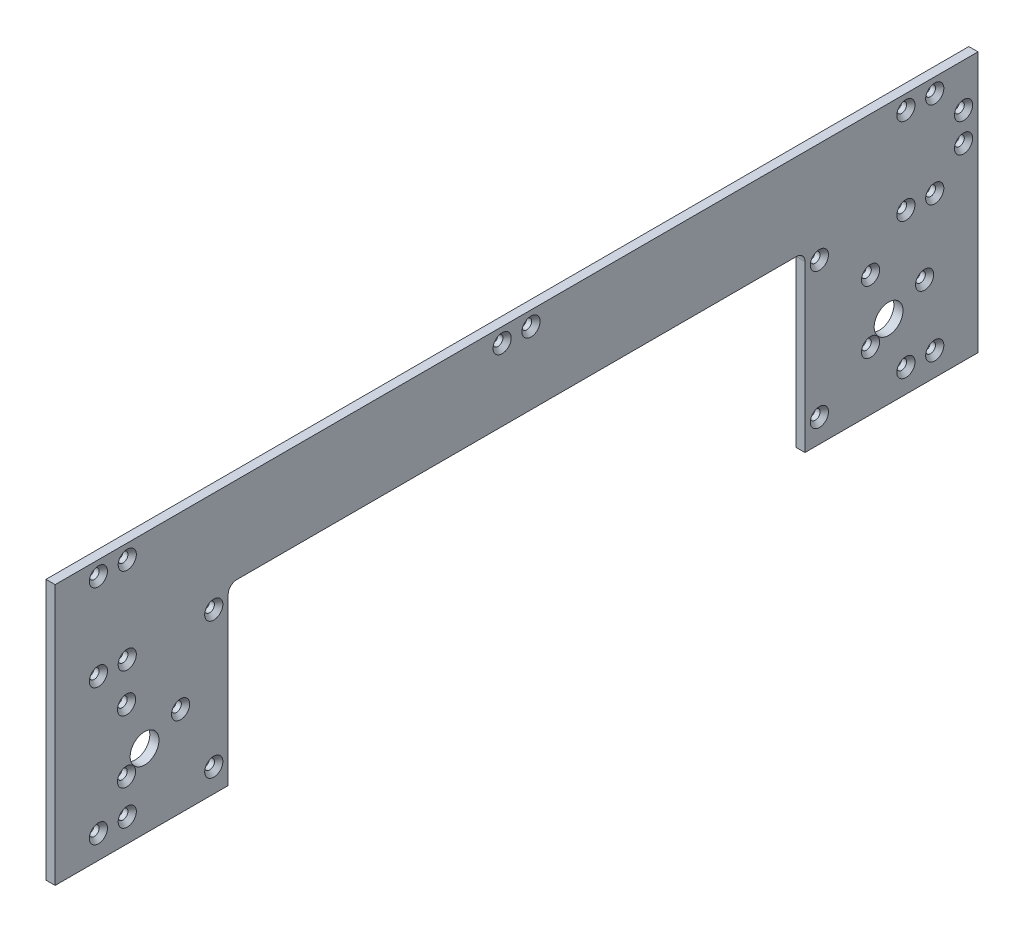
from build123d import *

# Parameters (mm, degrees)
BOSS_EXTRUDE1_DEPTH                             = 3.175
CSK_FOR_M3_FLAT_HEAD_MACHINE_SCREW1_D           = 3.4
CSK_FOR_M3_FLAT_HEAD_MACHINE_SCREW1_CSINK_D     = 6.3
CSK_FOR_M3_FLAT_HEAD_MACHINE_SCREW1_CSINK_ANGLE = 90
SKETCH4_R                                       = 5
CUT_EXTRUDE1_DEPTH                              = 184.774870766
CSK_FOR_M3_FLAT_HEAD_MACHINE_SCREW2_D           = 3.4
CSK_FOR_M3_FLAT_HEAD_MACHINE_SCREW2_CSINK_D     = 6.3
CSK_FOR_M3_FLAT_HEAD_MACHINE_SCREW2_CSINK_ANGLE = 90
CSK_FOR_M3_FLAT_HEAD_MACHINE_SCREW3_D           = 3.4
CSK_FOR_M3_FLAT_HEAD_MACHINE_SCREW3_CSINK_D     = 6.3
CSK_FOR_M3_FLAT_HEAD_MACHINE_SCREW3_CSINK_ANGLE = 90
LPATTERN1_COUNT                                 = 2
LPATTERN1_PITCH                                 = 258


with BuildPart() as part:
    # Sketch1 → Boss-Extrude1 (new body)
    with BuildSketch(Plane(origin=(0, 0, 0), x_dir=(0, 0, -1), z_dir=(1, 0, 0))):
        Polygon((160, 0), (160, 3.175), (160, 47.175), (160, 50.35), (160, 60.35), (160, 90.35), (-160, 90.35), (-160, 60.35), (-160, 50.35), (-160, 47.175), (-160, 3.175), (-160, 0), align=None)
    extrude(amount=BOSS_EXTRUDE1_DEPTH)

    # CSK for M3 Flat Head Machine Screw1 (through all)
    with Locations(Plane(origin=(3.175, 0, 0), x_dir=(0, 0, -1), z_dir=(1, 0, 0))):
        with Locations((-145, 8.175), (-135, 8.175), (-105, 8.175), (-145, 55.35), (-135, 55.35), (-105, 55.35), (-145, 85.35), (-135, 85.35), (-5, 85.35)):
            csk_for_m3_flat_head_machine_screw1 = CounterSinkHole(CSK_FOR_M3_FLAT_HEAD_MACHINE_SCREW1_D / 2, CSK_FOR_M3_FLAT_HEAD_MACHINE_SCREW1_CSINK_D / 2, counter_sink_angle=CSK_FOR_M3_FLAT_HEAD_MACHINE_SCREW1_CSINK_ANGLE)

    # Mirror1: CSK for M3 Flat Head Machine Screw1 across plane
    add(csk_for_m3_flat_head_machine_screw1.mirror(Plane.XY), mode=Mode.SUBTRACT)

    # Sketch4 → Cut-Extrude1 (cut, through all)
    with BuildSketch(Plane(origin=(3.175, 0, 0), x_dir=(0, 0, -1), z_dir=(1, 0, 0))):
        with Locations((-129, 25.675)):
            Circle(SKETCH4_R)
        with Locations((129, 25.675)):
            Circle(SKETCH4_R)
        with BuildLine():
            Line((-100, 57.35), (-100, 0))
            Line((-100, 0), (100, 0))
            Line((100, 0), (100, 57.35))
            ThreePointArc((100, 57.35), (99.121320344, 59.471320344), (97, 60.35))
            Line((97, 60.35), (-97, 60.35))
            ThreePointArc((-97, 60.35), (-99.121320344, 59.471320344), (-100, 57.35))
        make_face()
    extrude(amount=-CUT_EXTRUDE1_DEPTH, mode=Mode.SUBTRACT)

    # CSK for M3 Flat Head Machine Screw2 (through all)
    with Locations(Plane(origin=(3.175, 0, 0), x_dir=(0, 0, -1), z_dir=(1, 0, 0))):
        with Locations((155, 65.35), (155, 75.35)):
            CounterSinkHole(CSK_FOR_M3_FLAT_HEAD_MACHINE_SCREW2_D / 2, CSK_FOR_M3_FLAT_HEAD_MACHINE_SCREW2_CSINK_D / 2, counter_sink_angle=CSK_FOR_M3_FLAT_HEAD_MACHINE_SCREW2_CSINK_ANGLE)

    # CSK for M3 Flat Head Machine Screw3 (through all)
    with Locations(Plane(origin=(3.175, 0, 0), x_dir=(0, 0, -1), z_dir=(1, 0, 0))):
        with Locations((-116.5, 31.175), (-135.25, 20.349682453), (-135.25, 42.000317547)):
            csk_for_m3_flat_head_machine_screw3 = CounterSinkHole(CSK_FOR_M3_FLAT_HEAD_MACHINE_SCREW3_D / 2, CSK_FOR_M3_FLAT_HEAD_MACHINE_SCREW3_CSINK_D / 2, counter_sink_angle=CSK_FOR_M3_FLAT_HEAD_MACHINE_SCREW3_CSINK_ANGLE)

    # LPattern1: CSK for M3 Flat Head Machine Screw3 ×2
    with Locations(*[(0, 0, -i * LPATTERN1_PITCH) for i in range(1, LPATTERN1_COUNT)]):
        add(csk_for_m3_flat_head_machine_screw3, mode=Mode.SUBTRACT)


solid = part.part
